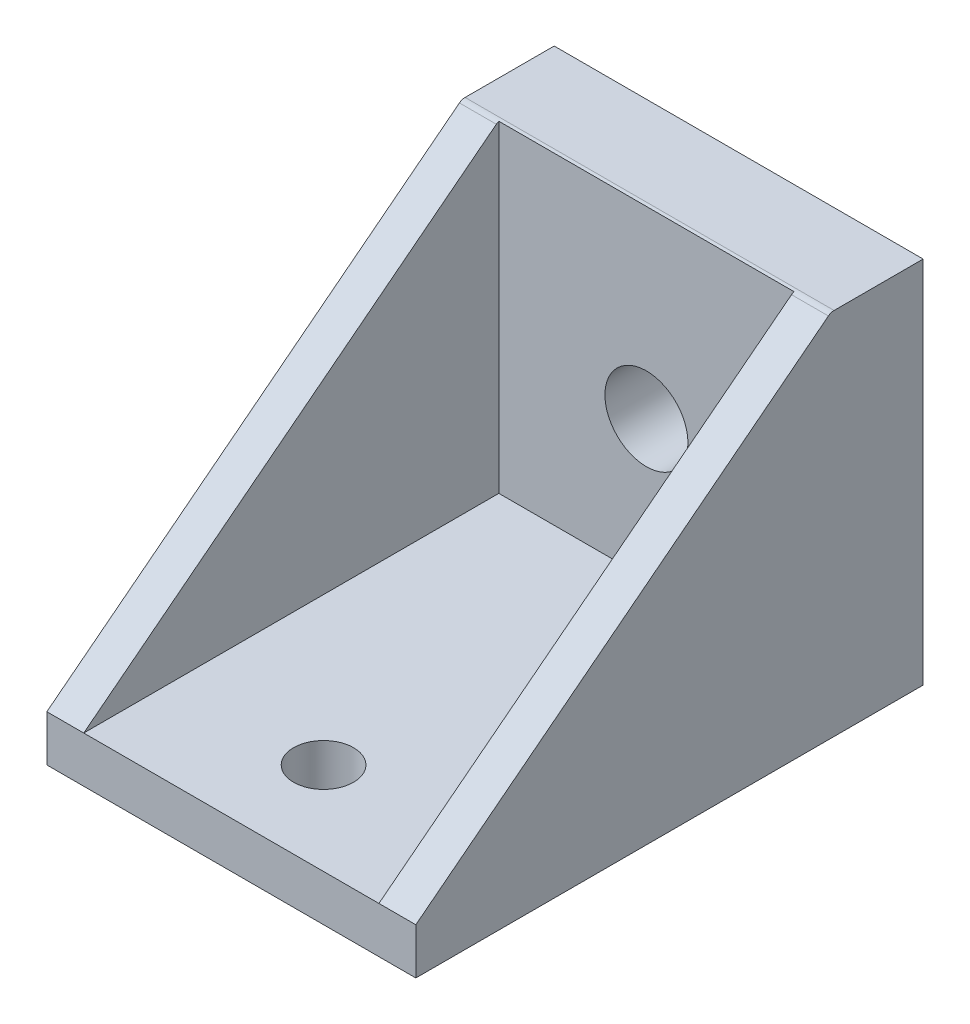
from build123d import *

# Parameters (mm, degrees)
CROQUIS1_W              = 40
CROQUIS1_H              = 40
CROQUIS1_R              = 4.5
SALIENTE_EXTRUIR1_DEPTH = 10
CROQUIS2_W              = 40
CROQUIS2_H              = 55
CROQUIS2_R              = 3.25
SALIENTE_EXTRUIR2_DEPTH = 5
SALIENTE_EXTRUIR3_DEPTH = 4
REDONDEO1_START         = -21
REDONDEO1_DEPTH         = 42


with BuildPart() as part:
    # Croquis1 → Saliente-Extruir1 (new body)
    with BuildSketch(Plane.XY):
        Rectangle(CROQUIS1_W, CROQUIS1_H)
        Circle(CROQUIS1_R, mode=Mode.SUBTRACT)
    extrude(amount=SALIENTE_EXTRUIR1_DEPTH)

    # Croquis2 → Saliente-Extruir2 (add)
    with BuildSketch(Plane.XZ.offset(20)):
        with Locations((0, 27.5)):
            Rectangle(CROQUIS2_W, CROQUIS2_H)
        with Locations(Location((0, 45, 0), (0, 0, 270))):
            Circle(CROQUIS2_R, mode=Mode.SUBTRACT)
    extrude(amount=-SALIENTE_EXTRUIR2_DEPTH)

    # Croquis3 → Saliente-Extruir3 (add)
    with BuildSketch(Plane(origin=(20, 0, 0), x_dir=(0, 0, -1), z_dir=(1, 0, 0))):
        Polygon((-55, -15), (-10, 20), (-10, -15), align=None)
    saliente_extruir3 = extrude(amount=-SALIENTE_EXTRUIR3_DEPTH)

    # Simetría1: Saliente-Extruir3 across plane
    add(saliente_extruir3.mirror(Plane(origin=(0, 0, 0), x_dir=(0, 0, 1), z_dir=(1, 0, 0))))

    # Redondeo1: read off the stored shape, not the designer's step
    # Redondeo1 outline → Redondeo1 (cut)
    with BuildSketch(Plane.YZ.offset(REDONDEO1_START)):
        with BuildLine():
            Line((20, 9.65689225), (20, 10))
            Line((20, 10), (19.789352217, 10.270832863))
            ThreePointArc((19.789352217, 10.270832863), (19.945873199, 9.981428675), (20, 9.65689225))
        make_face()
    extrude(amount=REDONDEO1_DEPTH, mode=Mode.SUBTRACT)


solid = part.part
